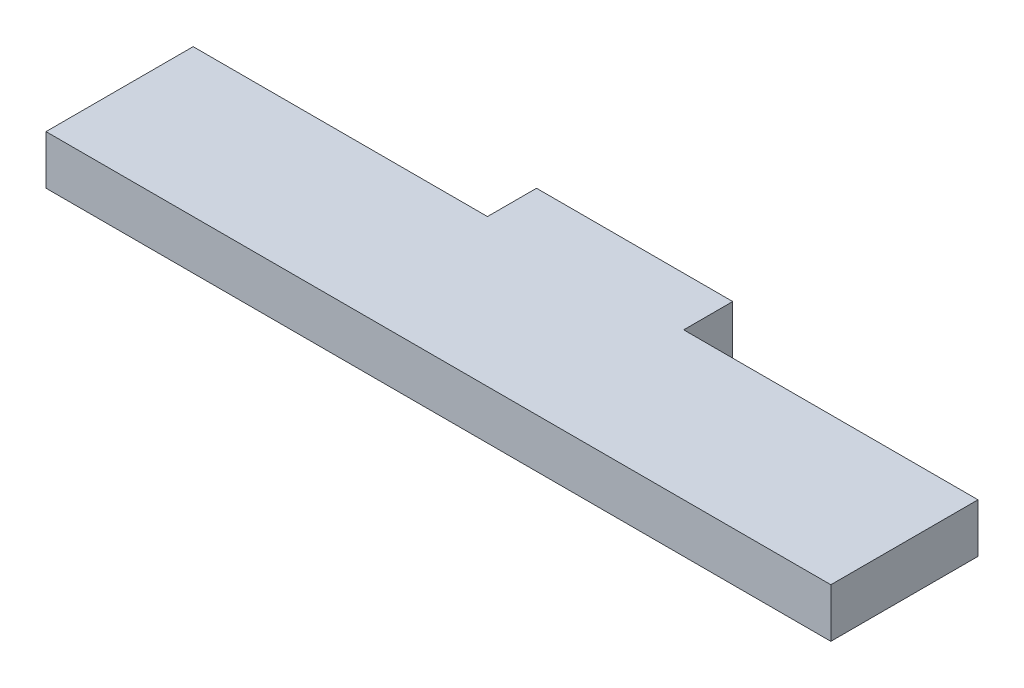
from build123d import *

# Parameters (mm, degrees)
SKETCH1_W               = 101.6
SKETCH1_H               = 25.4
BOSS_EXTRUDE1_DEPTH     = 6.35
CUT_EXTRUDE1_DEPTH      = 83.925474027
CUT_EXTRUDE1_DEPTH_BACK = 83.925474027
SKETCH2_W               = 38.1
SKETCH2_H               = 6.35


with BuildPart() as part:
    # Sketch1 → Boss-Extrude1 (new body)
    with BuildSketch(Plane(origin=(0, 0, 0), x_dir=(1, 0, 0), z_dir=(0, 1, 0))):
        with Locations((29.657499604, 6.35)):
            Rectangle(SKETCH1_W, SKETCH1_H)
    extrude(amount=BOSS_EXTRUDE1_DEPTH)

    # Sketch2 → Cut-Extrude1 (cut, two sides: drawn at the far end of the back side and taken through both)
    with BuildSketch(Plane(origin=(0, 6.35, 0), x_dir=(1, 0, 0), z_dir=(0, 1, 0)).offset(-CUT_EXTRUDE1_DEPTH_BACK)):
        with Locations((-2.092500396, 15.875)):
            Rectangle(SKETCH2_W, SKETCH2_H)
        with Locations((61.407499604, 15.875)):
            Rectangle(SKETCH2_W, SKETCH2_H)
    extrude(amount=CUT_EXTRUDE1_DEPTH + CUT_EXTRUDE1_DEPTH_BACK, mode=Mode.SUBTRACT)


solid = part.part
